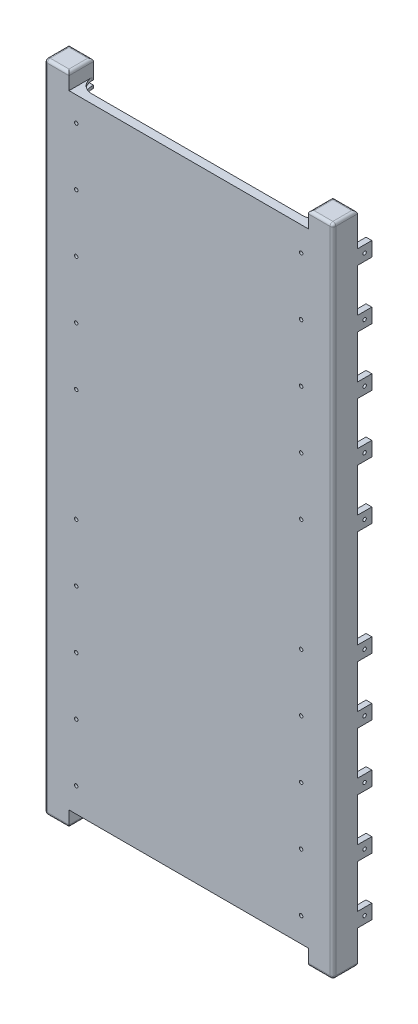
from build123d import *

# Parameters (mm, degrees)
BOSS_EXTRUDE1_DEPTH             = 227
FILLET1_R                       = 1
SKETCH2_W                       = 2
SKETCH2_H                       = 5
BOSS_EXTRUDE2_DEPTH             = 5
BOSS_EXTRUDE6_START             = -41.5
SKETCH13_W                      = 0.2
SKETCH13_H                      = 214
BOSS_EXTRUDE6_DEPTH             = 41.5
F_0_80_TAPPED_HOLE1_AT_2_COUNT  = 2
F_0_80_TAPPED_HOLE1_AT_2_PITCH  = 20
F_0_80_TAPPED_HOLE1_AT_3_COUNT  = 2
F_0_80_TAPPED_HOLE1_AT_3_PITCH  = 40
F_0_80_TAPPED_HOLE1_AT_4_COUNT  = 2
F_0_80_TAPPED_HOLE1_AT_4_PITCH  = 60
F_0_80_TAPPED_HOLE1_AT_5_COUNT  = 2
F_0_80_TAPPED_HOLE1_AT_5_PITCH  = 80
F_0_80_TAPPED_HOLE1_AT_6_COUNT  = 2
F_0_80_TAPPED_HOLE1_AT_6_PITCH  = 119
F_0_80_TAPPED_HOLE1_AT_7_COUNT  = 2
F_0_80_TAPPED_HOLE1_AT_7_PITCH  = 139
F_0_80_TAPPED_HOLE1_AT_8_COUNT  = 2
F_0_80_TAPPED_HOLE1_AT_8_PITCH  = 159
F_0_80_TAPPED_HOLE1_AT_9_COUNT  = 2
F_0_80_TAPPED_HOLE1_AT_9_PITCH  = 179
F_0_80_TAPPED_HOLE1_AT_10_COUNT = 2
F_0_80_TAPPED_HOLE1_AT_10_PITCH = 199
FILLET2_START                   = 2.25
FILLET2_DEPTH                   = 1.8
FILLET2_2_DEPTH                 = 2
CUT_EXTRUDE1_START              = -6.5
SKETCH3_W                       = 6.5
SKETCH3_H                       = 6.5
CUT_EXTRUDE1_DEPTH              = 214
MIRROR7_COPY_10_SKETCH_W        = 2
MIRROR7_COPY_10_SKETCH_H        = 5
MIRROR7_COPY_10_DEPTH           = 5
FILLET1_OF_MIRROR7_R            = 1
SKETCH14_W                      = 8.5
SKETCH14_H                      = 1
BOSS_EXTRUDE7_DEPTH             = 96
CUT_EXTRUDE2_DEPTH              = 242.486800882


with BuildPart() as part:
    # Sketch1 → Boss-Extrude1 (new body)
    with BuildSketch(Plane(origin=(0, 0, 0), x_dir=(1, 0, 0), z_dir=(0, 1, 0))):
        with BuildLine():
            Line((-3.25, -4.25), (4.25, -4.25))
            Line((4.25, -4.25), (4.25, 4.25))
            Line((4.25, 4.25), (-4.25, 4.25))
            Line((-4.25, 4.25), (-4.25, -3.25))
            ThreePointArc((-4.25, -3.25), (-3.957106781, -3.957106781), (-3.25, -4.25))
        make_face()
    boss_extrude1 = extrude(amount=BOSS_EXTRUDE1_DEPTH)

    # Fillet1
    fillet1_edges = [part.edges().sort_by_distance(p)[0] for p in [
        (-4.25, 227, -0.5),
        (-3.957106781, 227, 3.957106781),
        (0.5, 227, 4.25),
        (4.25, 227, 0),
        (0.5, 0, 4.25),
        (-3.957106781, 0, 3.957106781),
        (-4.25, 0, -0.5),
        (0, 0, -4.25),
        (4.25, 0, 0),
        (0, 227, -4.25),
    ]]
    fillet(fillet1_edges, radius=FILLET1_R)

    # Sketch2 → Boss-Extrude2 (add)
    with BuildSketch(Plane(origin=(4.25, 0, 0), x_dir=(0, 0, -1), z_dir=(1, 0, 0))):
        with Locations((-3.25, 213)):
            Rectangle(SKETCH2_W, SKETCH2_H)
        with Locations((-3.25, 193)):
            Rectangle(SKETCH2_W, SKETCH2_H)
        with Locations((-3.25, 173)):
            Rectangle(SKETCH2_W, SKETCH2_H)
        with Locations((-3.25, 153)):
            Rectangle(SKETCH2_W, SKETCH2_H)
        with Locations((-3.25, 133)):
            Rectangle(SKETCH2_W, SKETCH2_H)
        with Locations((-3.25, 94)):
            Rectangle(SKETCH2_W, SKETCH2_H)
        with Locations((-3.25, 74)):
            Rectangle(SKETCH2_W, SKETCH2_H)
        with Locations((-3.25, 54)):
            Rectangle(SKETCH2_W, SKETCH2_H)
        with Locations((-3.25, 34)):
            Rectangle(SKETCH2_W, SKETCH2_H)
        with Locations((-3.25, 14)):
            Rectangle(SKETCH2_W, SKETCH2_H)
    boss_extrude2 = extrude(amount=BOSS_EXTRUDE2_DEPTH)

    # Sketch13 → Boss-Extrude6 (add)
    with BuildSketch(Plane.ZY.offset(-4.25).offset(BOSS_EXTRUDE6_START)):
        with Locations((4.15, 113.5)):
            Rectangle(SKETCH13_W, SKETCH13_H)
    boss_extrude6 = extrude(amount=BOSS_EXTRUDE6_DEPTH)

    # Sketch11 → #0-80 Tapped Hole1 (revolve, cut)
    with BuildSketch(Plane(origin=(6.75, 213, 4.25), x_dir=(0, -1, 0), z_dir=(1, 0, 0))):
        Polygon((0, 0), (0, 4.358390611), (0.59563, 4.0005), (0.59563, 0), align=None)
    f_0_80_tapped_hole1 = revolve(axis=Axis((6.75, 213, 10.6), (0, 0, -1)), mode=Mode.SUBTRACT)

    # #0-80 Tapped Hole1 at 2: #0-80 Tapped Hole1 ×2
    with Locations(*[(0, -i * F_0_80_TAPPED_HOLE1_AT_2_PITCH, 0) for i in range(1, F_0_80_TAPPED_HOLE1_AT_2_COUNT)]):
        add(f_0_80_tapped_hole1, mode=Mode.SUBTRACT)

    # #0-80 Tapped Hole1 at 3: #0-80 Tapped Hole1 ×2
    with Locations(*[(0, -i * F_0_80_TAPPED_HOLE1_AT_3_PITCH, 0) for i in range(1, F_0_80_TAPPED_HOLE1_AT_3_COUNT)]):
        add(f_0_80_tapped_hole1, mode=Mode.SUBTRACT)

    # #0-80 Tapped Hole1 at 4: #0-80 Tapped Hole1 ×2
    with Locations(*[(0, -i * F_0_80_TAPPED_HOLE1_AT_4_PITCH, 0) for i in range(1, F_0_80_TAPPED_HOLE1_AT_4_COUNT)]):
        add(f_0_80_tapped_hole1, mode=Mode.SUBTRACT)

    # #0-80 Tapped Hole1 at 5: #0-80 Tapped Hole1 ×2
    with Locations(*[(0, -i * F_0_80_TAPPED_HOLE1_AT_5_PITCH, 0) for i in range(1, F_0_80_TAPPED_HOLE1_AT_5_COUNT)]):
        add(f_0_80_tapped_hole1, mode=Mode.SUBTRACT)

    # #0-80 Tapped Hole1 at 6: #0-80 Tapped Hole1 ×2
    with Locations(*[(0, -i * F_0_80_TAPPED_HOLE1_AT_6_PITCH, 0) for i in range(1, F_0_80_TAPPED_HOLE1_AT_6_COUNT)]):
        add(f_0_80_tapped_hole1, mode=Mode.SUBTRACT)

    # #0-80 Tapped Hole1 at 7: #0-80 Tapped Hole1 ×2
    with Locations(*[(0, -i * F_0_80_TAPPED_HOLE1_AT_7_PITCH, 0) for i in range(1, F_0_80_TAPPED_HOLE1_AT_7_COUNT)]):
        add(f_0_80_tapped_hole1, mode=Mode.SUBTRACT)

    # #0-80 Tapped Hole1 at 8: #0-80 Tapped Hole1 ×2
    with Locations(*[(0, -i * F_0_80_TAPPED_HOLE1_AT_8_PITCH, 0) for i in range(1, F_0_80_TAPPED_HOLE1_AT_8_COUNT)]):
        add(f_0_80_tapped_hole1, mode=Mode.SUBTRACT)

    # #0-80 Tapped Hole1 at 9: #0-80 Tapped Hole1 ×2
    with Locations(*[(0, -i * F_0_80_TAPPED_HOLE1_AT_9_PITCH, 0) for i in range(1, F_0_80_TAPPED_HOLE1_AT_9_COUNT)]):
        add(f_0_80_tapped_hole1, mode=Mode.SUBTRACT)

    # #0-80 Tapped Hole1 at 10: #0-80 Tapped Hole1 ×2
    with Locations(*[(0, -i * F_0_80_TAPPED_HOLE1_AT_10_PITCH, 0) for i in range(1, F_0_80_TAPPED_HOLE1_AT_10_COUNT)]):
        add(f_0_80_tapped_hole1, mode=Mode.SUBTRACT)

    # Fillet2: read off the stored shape, not the designer's step
    # Fillet2 outline → Fillet2 (cut)
    with BuildSketch(Plane.XY.offset(FILLET2_START)):
        with BuildLine():
            Line((9.25, 215.5), (6.75, 215.5))
            ThreePointArc((6.75, 215.5), (8.517766953, 214.767766953), (9.25, 213))
            Line((9.25, 213), (9.25, 215.5))
        make_face()
        with BuildLine():
            Line((9.25, 195.5), (6.75, 195.5))
            ThreePointArc((6.75, 195.5), (8.517766953, 194.767766953), (9.25, 193))
            Line((9.25, 193), (9.25, 195.5))
        make_face()
        with BuildLine():
            Line((9.25, 175.5), (6.75, 175.5))
            ThreePointArc((6.75, 175.5), (8.517766953, 174.767766953), (9.25, 173))
            Line((9.25, 173), (9.25, 175.5))
        make_face()
        with BuildLine():
            Line((9.25, 155.5), (6.75, 155.5))
            ThreePointArc((6.75, 155.5), (8.517766953, 154.767766953), (9.25, 153))
            Line((9.25, 153), (9.25, 155.5))
        make_face()
        with BuildLine():
            Line((9.25, 135.5), (6.75, 135.5))
            ThreePointArc((6.75, 135.5), (8.517766953, 134.767766953), (9.25, 133))
            Line((9.25, 133), (9.25, 135.5))
        make_face()
        with BuildLine():
            ThreePointArc((9.25, 94), (8.517766953, 92.232233047), (6.75, 91.5))
            Line((6.75, 91.5), (9.25, 91.5))
            Line((9.25, 91.5), (9.25, 94))
        make_face()
        with BuildLine():
            ThreePointArc((9.25, 74), (8.517766953, 72.232233047), (6.75, 71.5))
            Line((6.75, 71.5), (9.25, 71.5))
            Line((9.25, 71.5), (9.25, 74))
        make_face()
        with BuildLine():
            ThreePointArc((9.25, 54), (8.517766953, 52.232233047), (6.75, 51.5))
            Line((6.75, 51.5), (9.25, 51.5))
            Line((9.25, 51.5), (9.25, 54))
        make_face()
        with BuildLine():
            ThreePointArc((9.25, 34), (8.517766953, 32.232233047), (6.75, 31.5))
            Line((6.75, 31.5), (9.25, 31.5))
            Line((9.25, 31.5), (9.25, 34))
        make_face()
        with BuildLine():
            ThreePointArc((9.25, 14), (8.517766953, 12.232233047), (6.75, 11.5))
            Line((6.75, 11.5), (9.25, 11.5))
            Line((9.25, 11.5), (9.25, 14))
        make_face()
    fillet2 = extrude(amount=FILLET2_DEPTH, mode=Mode.SUBTRACT)

    # Fillet2 2 outline → Fillet2 2 (add)
    with BuildSketch(Plane.XY.offset(FILLET2_START)):
        with BuildLine():
            Line((4.25, 215.5), (6.75, 215.5))
            ThreePointArc((6.75, 215.5), (4.982233047, 216.232233047), (4.25, 218))
            Line((4.25, 218), (4.25, 215.5))
        make_face()
        with BuildLine():
            Line((6.75, 11.5), (4.25, 11.5))
            Line((4.25, 11.5), (4.25, 9))
            ThreePointArc((4.25, 9), (4.982233047, 10.767766953), (6.75, 11.5))
        make_face()
        with BuildLine():
            Line((6.75, 31.5), (4.25, 31.5))
            Line((4.25, 31.5), (4.25, 29))
            ThreePointArc((4.25, 29), (4.982233047, 30.767766953), (6.75, 31.5))
        make_face()
        with BuildLine():
            Line((6.75, 51.5), (4.25, 51.5))
            Line((4.25, 51.5), (4.25, 49))
            ThreePointArc((4.25, 49), (4.982233047, 50.767766953), (6.75, 51.5))
        make_face()
        with BuildLine():
            Line((6.75, 71.5), (4.25, 71.5))
            Line((4.25, 71.5), (4.25, 69))
            ThreePointArc((4.25, 69), (4.982233047, 70.767766953), (6.75, 71.5))
        make_face()
        with BuildLine():
            Line((6.75, 91.5), (4.25, 91.5))
            Line((4.25, 91.5), (4.25, 89))
            ThreePointArc((4.25, 89), (4.982233047, 90.767766953), (6.75, 91.5))
        make_face()
        with BuildLine():
            ThreePointArc((6.75, 135.5), (4.982233047, 136.232233047), (4.25, 138))
            Line((4.25, 138), (4.25, 135.5))
            Line((4.25, 135.5), (6.75, 135.5))
        make_face()
        with BuildLine():
            ThreePointArc((6.75, 155.5), (4.982233047, 156.232233047), (4.25, 158))
            Line((4.25, 158), (4.25, 155.5))
            Line((4.25, 155.5), (6.75, 155.5))
        make_face()
        with BuildLine():
            ThreePointArc((6.75, 175.5), (4.982233047, 176.232233047), (4.25, 178))
            Line((4.25, 178), (4.25, 175.5))
            Line((4.25, 175.5), (6.75, 175.5))
        make_face()
        with BuildLine():
            ThreePointArc((6.75, 195.5), (4.982233047, 196.232233047), (4.25, 198))
            Line((4.25, 198), (4.25, 195.5))
            Line((4.25, 195.5), (6.75, 195.5))
        make_face()
    fillet2_2 = extrude(amount=FILLET2_2_DEPTH)

    # Mirror1: Boss-Extrude2, #0-80 Tapped Hole1 across plane
    add(boss_extrude2.mirror(Plane(origin=(0, 0, 0), x_dir=(-0.7071067811865478, 0, 0.7071067811865472), z_dir=(-0.7071067811865475, 0, -0.7071067811865477))))
    add(f_0_80_tapped_hole1.mirror(Plane(origin=(0, 0, 0), x_dir=(-0.7071067811865478, 0, 0.7071067811865472), z_dir=(-0.7071067811865475, 0, -0.7071067811865477))), mode=Mode.SUBTRACT)

    # Mirror1 copy 1 sketch → Mirror1 copy 1 (revolve, cut)
    with BuildSketch(Plane(origin=(-4.25, 193, -6.75), x_dir=(0, -1, 0), z_dir=(0, 0, -1))):
        Polygon((0, 0), (0, -4.358390611), (0.59563, -4.0005), (0.59563, 0), align=None)
    revolve(axis=Axis((-10.6, 193, -6.75), (-1, 0, 0)), mode=Mode.SUBTRACT)

    # Mirror1 copy 2 sketch → Mirror1 copy 2 (revolve, cut)
    with BuildSketch(Plane(origin=(-4.25, 173, -6.75), x_dir=(0, -1, 0), z_dir=(0, 0, -1))):
        Polygon((0, 0), (0, -4.358390611), (0.59563, -4.0005), (0.59563, 0), align=None)
    revolve(axis=Axis((-10.6, 173, -6.75), (-1, 0, 0)), mode=Mode.SUBTRACT)

    # Mirror1 copy 3 sketch → Mirror1 copy 3 (revolve, cut)
    with BuildSketch(Plane(origin=(-4.25, 153, -6.75), x_dir=(0, -1, 0), z_dir=(0, 0, -1))):
        Polygon((0, 0), (0, -4.358390611), (0.59563, -4.0005), (0.59563, 0), align=None)
    revolve(axis=Axis((-10.6, 153, -6.75), (-1, 0, 0)), mode=Mode.SUBTRACT)

    # Mirror1 copy 4 sketch → Mirror1 copy 4 (revolve, cut)
    with BuildSketch(Plane(origin=(-4.25, 133, -6.75), x_dir=(0, -1, 0), z_dir=(0, 0, -1))):
        Polygon((0, 0), (0, -4.358390611), (0.59563, -4.0005), (0.59563, 0), align=None)
    revolve(axis=Axis((-10.6, 133, -6.75), (-1, 0, 0)), mode=Mode.SUBTRACT)

    # Mirror1 copy 5 sketch → Mirror1 copy 5 (revolve, cut)
    with BuildSketch(Plane(origin=(-4.25, 94, -6.75), x_dir=(0, -1, 0), z_dir=(0, 0, -1))):
        Polygon((0, 0), (0, -4.358390611), (0.59563, -4.0005), (0.59563, 0), align=None)
    revolve(axis=Axis((-10.6, 94, -6.75), (-1, 0, 0)), mode=Mode.SUBTRACT)

    # Mirror1 copy 6 sketch → Mirror1 copy 6 (revolve, cut)
    with BuildSketch(Plane(origin=(-4.25, 74, -6.75), x_dir=(0, -1, 0), z_dir=(0, 0, -1))):
        Polygon((0, 0), (0, -4.358390611), (0.59563, -4.0005), (0.59563, 0), align=None)
    revolve(axis=Axis((-10.6, 74, -6.75), (-1, 0, 0)), mode=Mode.SUBTRACT)

    # Mirror1 copy 7 sketch → Mirror1 copy 7 (revolve, cut)
    with BuildSketch(Plane(origin=(-4.25, 54, -6.75), x_dir=(0, -1, 0), z_dir=(0, 0, -1))):
        Polygon((0, 0), (0, -4.358390611), (0.59563, -4.0005), (0.59563, 0), align=None)
    revolve(axis=Axis((-10.6, 54, -6.75), (-1, 0, 0)), mode=Mode.SUBTRACT)

    # Mirror1 copy 8 sketch → Mirror1 copy 8 (revolve, cut)
    with BuildSketch(Plane(origin=(-4.25, 34, -6.75), x_dir=(0, -1, 0), z_dir=(0, 0, -1))):
        Polygon((0, 0), (0, -4.358390611), (0.59563, -4.0005), (0.59563, 0), align=None)
    revolve(axis=Axis((-10.6, 34, -6.75), (-1, 0, 0)), mode=Mode.SUBTRACT)

    # Mirror1 copy 9 sketch → Mirror1 copy 9 (revolve, cut)
    with BuildSketch(Plane(origin=(-4.25, 14, -6.75), x_dir=(0, -1, 0), z_dir=(0, 0, -1))):
        Polygon((0, 0), (0, -4.358390611), (0.59563, -4.0005), (0.59563, 0), align=None)
    revolve(axis=Axis((-10.6, 14, -6.75), (-1, 0, 0)), mode=Mode.SUBTRACT)

    # Sketch3 → Cut-Extrude1 (cut)
    with BuildSketch(Plane(origin=(0, 227, 0), x_dir=(1, 0, 0), z_dir=(0, 1, 0)).offset(CUT_EXTRUDE1_START)):
        with Locations((1, 1)):
            Rectangle(SKETCH3_W, SKETCH3_H)
    cut_extrude1 = extrude(amount=-CUT_EXTRUDE1_DEPTH, mode=Mode.SUBTRACT)

    # Mirror7: Boss-Extrude1, Boss-Extrude2, Boss-Extrude6, #0-80 Tapped Hole1, Fillet2, Fillet2 2, Cut-Extrude1 across plane
    add(boss_extrude1.mirror(Plane.ZY.offset(-45.75)))
    add(boss_extrude2.mirror(Plane.ZY.offset(-45.75)))
    add(boss_extrude6.mirror(Plane.ZY.offset(-45.75)))
    add(f_0_80_tapped_hole1.mirror(Plane.ZY.offset(-45.75)), mode=Mode.SUBTRACT)
    add(fillet2.mirror(Plane.ZY.offset(-45.75)), mode=Mode.SUBTRACT)
    add(fillet2_2.mirror(Plane.ZY.offset(-45.75)))
    add(cut_extrude1.mirror(Plane.ZY.offset(-45.75)), mode=Mode.SUBTRACT)

    # Mirror7 copy 1 sketch → Mirror7 copy 1 (revolve, cut)
    with BuildSketch(Plane(origin=(84.75, 193, 4.25), x_dir=(0, -1, 0), z_dir=(-1, 0, 0))):
        Polygon((0, 0), (0, -4.358390611), (0.59563, -4.0005), (0.59563, 0), align=None)
    revolve(axis=Axis((84.75, 193, 10.6), (0, 0, 1)), mode=Mode.SUBTRACT)

    # Mirror7 copy 2 sketch → Mirror7 copy 2 (revolve, cut)
    with BuildSketch(Plane(origin=(84.75, 173, 4.25), x_dir=(0, -1, 0), z_dir=(-1, 0, 0))):
        Polygon((0, 0), (0, -4.358390611), (0.59563, -4.0005), (0.59563, 0), align=None)
    revolve(axis=Axis((84.75, 173, 10.6), (0, 0, 1)), mode=Mode.SUBTRACT)

    # Mirror7 copy 3 sketch → Mirror7 copy 3 (revolve, cut)
    with BuildSketch(Plane(origin=(84.75, 153, 4.25), x_dir=(0, -1, 0), z_dir=(-1, 0, 0))):
        Polygon((0, 0), (0, -4.358390611), (0.59563, -4.0005), (0.59563, 0), align=None)
    revolve(axis=Axis((84.75, 153, 10.6), (0, 0, 1)), mode=Mode.SUBTRACT)

    # Mirror7 copy 4 sketch → Mirror7 copy 4 (revolve, cut)
    with BuildSketch(Plane(origin=(84.75, 133, 4.25), x_dir=(0, -1, 0), z_dir=(-1, 0, 0))):
        Polygon((0, 0), (0, -4.358390611), (0.59563, -4.0005), (0.59563, 0), align=None)
    revolve(axis=Axis((84.75, 133, 10.6), (0, 0, 1)), mode=Mode.SUBTRACT)

    # Mirror7 copy 5 sketch → Mirror7 copy 5 (revolve, cut)
    with BuildSketch(Plane(origin=(84.75, 94, 4.25), x_dir=(0, -1, 0), z_dir=(-1, 0, 0))):
        Polygon((0, 0), (0, -4.358390611), (0.59563, -4.0005), (0.59563, 0), align=None)
    revolve(axis=Axis((84.75, 94, 10.6), (0, 0, 1)), mode=Mode.SUBTRACT)

    # Mirror7 copy 6 sketch → Mirror7 copy 6 (revolve, cut)
    with BuildSketch(Plane(origin=(84.75, 74, 4.25), x_dir=(0, -1, 0), z_dir=(-1, 0, 0))):
        Polygon((0, 0), (0, -4.358390611), (0.59563, -4.0005), (0.59563, 0), align=None)
    revolve(axis=Axis((84.75, 74, 10.6), (0, 0, 1)), mode=Mode.SUBTRACT)

    # Mirror7 copy 7 sketch → Mirror7 copy 7 (revolve, cut)
    with BuildSketch(Plane(origin=(84.75, 54, 4.25), x_dir=(0, -1, 0), z_dir=(-1, 0, 0))):
        Polygon((0, 0), (0, -4.358390611), (0.59563, -4.0005), (0.59563, 0), align=None)
    revolve(axis=Axis((84.75, 54, 10.6), (0, 0, 1)), mode=Mode.SUBTRACT)

    # Mirror7 copy 8 sketch → Mirror7 copy 8 (revolve, cut)
    with BuildSketch(Plane(origin=(84.75, 34, 4.25), x_dir=(0, -1, 0), z_dir=(-1, 0, 0))):
        Polygon((0, 0), (0, -4.358390611), (0.59563, -4.0005), (0.59563, 0), align=None)
    revolve(axis=Axis((84.75, 34, 10.6), (0, 0, 1)), mode=Mode.SUBTRACT)

    # Mirror7 copy 9 sketch → Mirror7 copy 9 (revolve, cut)
    with BuildSketch(Plane(origin=(84.75, 14, 4.25), x_dir=(0, -1, 0), z_dir=(-1, 0, 0))):
        Polygon((0, 0), (0, -4.358390611), (0.59563, -4.0005), (0.59563, 0), align=None)
    revolve(axis=Axis((84.75, 14, 10.6), (0, 0, 1)), mode=Mode.SUBTRACT)

    # Mirror7 copy 10 sketch → Mirror7 copy 10 (add)
    with BuildSketch(Plane(origin=(91.5, 0, -4.25), x_dir=(-1, 0, 0), z_dir=(0, 0, -1))):
        with Locations((-3.25, 213)):
            Rectangle(MIRROR7_COPY_10_SKETCH_W, MIRROR7_COPY_10_SKETCH_H)
        with Locations((-3.25, 193)):
            Rectangle(MIRROR7_COPY_10_SKETCH_W, MIRROR7_COPY_10_SKETCH_H)
        with Locations((-3.25, 173)):
            Rectangle(MIRROR7_COPY_10_SKETCH_W, MIRROR7_COPY_10_SKETCH_H)
        with Locations((-3.25, 153)):
            Rectangle(MIRROR7_COPY_10_SKETCH_W, MIRROR7_COPY_10_SKETCH_H)
        with Locations((-3.25, 133)):
            Rectangle(MIRROR7_COPY_10_SKETCH_W, MIRROR7_COPY_10_SKETCH_H)
        with Locations((-3.25, 94)):
            Rectangle(MIRROR7_COPY_10_SKETCH_W, MIRROR7_COPY_10_SKETCH_H)
        with Locations((-3.25, 74)):
            Rectangle(MIRROR7_COPY_10_SKETCH_W, MIRROR7_COPY_10_SKETCH_H)
        with Locations((-3.25, 54)):
            Rectangle(MIRROR7_COPY_10_SKETCH_W, MIRROR7_COPY_10_SKETCH_H)
        with Locations((-3.25, 34)):
            Rectangle(MIRROR7_COPY_10_SKETCH_W, MIRROR7_COPY_10_SKETCH_H)
        with Locations((-3.25, 14)):
            Rectangle(MIRROR7_COPY_10_SKETCH_W, MIRROR7_COPY_10_SKETCH_H)
    extrude(amount=MIRROR7_COPY_10_DEPTH)

    # Mirror7 copy 11 sketch → Mirror7 copy 11 (revolve, cut)
    with BuildSketch(Plane(origin=(95.75, 213, -6.75), x_dir=(0, -1, 0), z_dir=(0, 0, -1))):
        Polygon((0, 0), (0, 4.358390611), (0.59563, 4.0005), (0.59563, 0), align=None)
    revolve(axis=Axis((102.1, 213, -6.75), (-1, 0, 0)), mode=Mode.SUBTRACT)

    # Mirror7 copy 12 sketch → Mirror7 copy 12 (revolve, cut)
    with BuildSketch(Plane(origin=(95.75, 193, -6.75), x_dir=(0, -1, 0), z_dir=(0, 0, -1))):
        Polygon((0, 0), (0, 4.358390611), (0.59563, 4.0005), (0.59563, 0), align=None)
    revolve(axis=Axis((102.1, 193, -6.75), (-1, 0, 0)), mode=Mode.SUBTRACT)

    # Mirror7 copy 13 sketch → Mirror7 copy 13 (revolve, cut)
    with BuildSketch(Plane(origin=(95.75, 173, -6.75), x_dir=(0, -1, 0), z_dir=(0, 0, -1))):
        Polygon((0, 0), (0, 4.358390611), (0.59563, 4.0005), (0.59563, 0), align=None)
    revolve(axis=Axis((102.1, 173, -6.75), (-1, 0, 0)), mode=Mode.SUBTRACT)

    # Mirror7 copy 14 sketch → Mirror7 copy 14 (revolve, cut)
    with BuildSketch(Plane(origin=(95.75, 153, -6.75), x_dir=(0, -1, 0), z_dir=(0, 0, -1))):
        Polygon((0, 0), (0, 4.358390611), (0.59563, 4.0005), (0.59563, 0), align=None)
    revolve(axis=Axis((102.1, 153, -6.75), (-1, 0, 0)), mode=Mode.SUBTRACT)

    # Mirror7 copy 15 sketch → Mirror7 copy 15 (revolve, cut)
    with BuildSketch(Plane(origin=(95.75, 133, -6.75), x_dir=(0, -1, 0), z_dir=(0, 0, -1))):
        Polygon((0, 0), (0, 4.358390611), (0.59563, 4.0005), (0.59563, 0), align=None)
    revolve(axis=Axis((102.1, 133, -6.75), (-1, 0, 0)), mode=Mode.SUBTRACT)

    # Mirror7 copy 16 sketch → Mirror7 copy 16 (revolve, cut)
    with BuildSketch(Plane(origin=(95.75, 94, -6.75), x_dir=(0, -1, 0), z_dir=(0, 0, -1))):
        Polygon((0, 0), (0, 4.358390611), (0.59563, 4.0005), (0.59563, 0), align=None)
    revolve(axis=Axis((102.1, 94, -6.75), (-1, 0, 0)), mode=Mode.SUBTRACT)

    # Mirror7 copy 17 sketch → Mirror7 copy 17 (revolve, cut)
    with BuildSketch(Plane(origin=(95.75, 74, -6.75), x_dir=(0, -1, 0), z_dir=(0, 0, -1))):
        Polygon((0, 0), (0, 4.358390611), (0.59563, 4.0005), (0.59563, 0), align=None)
    revolve(axis=Axis((102.1, 74, -6.75), (-1, 0, 0)), mode=Mode.SUBTRACT)

    # Mirror7 copy 18 sketch → Mirror7 copy 18 (revolve, cut)
    with BuildSketch(Plane(origin=(95.75, 54, -6.75), x_dir=(0, -1, 0), z_dir=(0, 0, -1))):
        Polygon((0, 0), (0, 4.358390611), (0.59563, 4.0005), (0.59563, 0), align=None)
    revolve(axis=Axis((102.1, 54, -6.75), (-1, 0, 0)), mode=Mode.SUBTRACT)

    # Mirror7 copy 19 sketch → Mirror7 copy 19 (revolve, cut)
    with BuildSketch(Plane(origin=(95.75, 34, -6.75), x_dir=(0, -1, 0), z_dir=(0, 0, -1))):
        Polygon((0, 0), (0, 4.358390611), (0.59563, 4.0005), (0.59563, 0), align=None)
    revolve(axis=Axis((102.1, 34, -6.75), (-1, 0, 0)), mode=Mode.SUBTRACT)

    # Mirror7 copy 20 sketch → Mirror7 copy 20 (revolve, cut)
    with BuildSketch(Plane(origin=(95.75, 14, -6.75), x_dir=(0, -1, 0), z_dir=(0, 0, -1))):
        Polygon((0, 0), (0, 4.358390611), (0.59563, 4.0005), (0.59563, 0), align=None)
    revolve(axis=Axis((102.1, 14, -6.75), (-1, 0, 0)), mode=Mode.SUBTRACT)

    # Fillet1 of Mirror7
    fillet1_of_mirror7_edges = [part.edges().sort_by_distance(p)[0] for p in [
        (95.75, 227, -0.5),
        (95.457106781, 227, 3.957106781),
        (91, 227, 4.25),
        (87.25, 227, 0),
        (91, 0, 4.25),
        (95.457106781, 0, 3.957106781),
        (95.75, 0, -0.5),
        (91.5, 0, -4.25),
        (87.25, 0, 0),
        (91.5, 227, -4.25),
    ]]
    fillet(fillet1_of_mirror7_edges, radius=FILLET1_OF_MIRROR7_R)

    # Sketch14 → Boss-Extrude7 (add)
    with BuildSketch(Plane(origin=(-2.25, 0, 0), x_dir=(0, 0, -1), z_dir=(1, 0, 0))):
        with Locations((0, 8.6)):
            Rectangle(SKETCH14_W, SKETCH14_H)
        with Locations((0, 18.6)):
            Rectangle(SKETCH14_W, SKETCH14_H)
        with Locations((0, 6)):
            Rectangle(SKETCH14_W, SKETCH14_H)
        with Locations((0, 16)):
            Rectangle(SKETCH14_W, SKETCH14_H)
        with Locations((0, 28.6)):
            Rectangle(SKETCH14_W, SKETCH14_H)
        with Locations((0, 26)):
            Rectangle(SKETCH14_W, SKETCH14_H)
        with Locations((0, 38.6)):
            Rectangle(SKETCH14_W, SKETCH14_H)
        with Locations((0, 36)):
            Rectangle(SKETCH14_W, SKETCH14_H)
        with Locations((0, 48.6)):
            Rectangle(SKETCH14_W, SKETCH14_H)
        with Locations((0, 46)):
            Rectangle(SKETCH14_W, SKETCH14_H)
        with Locations((0, 58.6)):
            Rectangle(SKETCH14_W, SKETCH14_H)
        with Locations((0, 56)):
            Rectangle(SKETCH14_W, SKETCH14_H)
        with Locations((0, 68.6)):
            Rectangle(SKETCH14_W, SKETCH14_H)
        with Locations((0, 66)):
            Rectangle(SKETCH14_W, SKETCH14_H)
        with Locations((0, 78.6)):
            Rectangle(SKETCH14_W, SKETCH14_H)
        with Locations((0, 76)):
            Rectangle(SKETCH14_W, SKETCH14_H)
        with Locations((0, 88.6)):
            Rectangle(SKETCH14_W, SKETCH14_H)
        with Locations((0, 86)):
            Rectangle(SKETCH14_W, SKETCH14_H)
        with Locations((0, 98.6)):
            Rectangle(SKETCH14_W, SKETCH14_H)
        with Locations((0, 96)):
            Rectangle(SKETCH14_W, SKETCH14_H)
        with Locations((0, 108.6)):
            Rectangle(SKETCH14_W, SKETCH14_H)
        with Locations((0, 106)):
            Rectangle(SKETCH14_W, SKETCH14_H)
        with Locations((0, 121)):
            Rectangle(SKETCH14_W, SKETCH14_H)
        with Locations((0, 118.4)):
            Rectangle(SKETCH14_W, SKETCH14_H)
        with Locations((0, 131)):
            Rectangle(SKETCH14_W, SKETCH14_H)
        with Locations((0, 128.4)):
            Rectangle(SKETCH14_W, SKETCH14_H)
        with Locations((0, 141)):
            Rectangle(SKETCH14_W, SKETCH14_H)
        with Locations((0, 138.4)):
            Rectangle(SKETCH14_W, SKETCH14_H)
        with Locations((0, 151)):
            Rectangle(SKETCH14_W, SKETCH14_H)
        with Locations((0, 148.4)):
            Rectangle(SKETCH14_W, SKETCH14_H)
        with Locations((0, 161)):
            Rectangle(SKETCH14_W, SKETCH14_H)
        with Locations((0, 158.4)):
            Rectangle(SKETCH14_W, SKETCH14_H)
        with Locations((0, 171)):
            Rectangle(SKETCH14_W, SKETCH14_H)
        with Locations((0, 168.4)):
            Rectangle(SKETCH14_W, SKETCH14_H)
        with Locations((0, 181)):
            Rectangle(SKETCH14_W, SKETCH14_H)
        with Locations((0, 178.4)):
            Rectangle(SKETCH14_W, SKETCH14_H)
        with Locations((0, 191)):
            Rectangle(SKETCH14_W, SKETCH14_H)
        with Locations((0, 188.4)):
            Rectangle(SKETCH14_W, SKETCH14_H)
        with Locations((0, 201)):
            Rectangle(SKETCH14_W, SKETCH14_H)
        with Locations((0, 198.4)):
            Rectangle(SKETCH14_W, SKETCH14_H)
        with Locations((0, 211)):
            Rectangle(SKETCH14_W, SKETCH14_H)
        with Locations((0, 208.4)):
            Rectangle(SKETCH14_W, SKETCH14_H)
        with Locations((0, 221)):
            Rectangle(SKETCH14_W, SKETCH14_H)
        with Locations((0, 218.4)):
            Rectangle(SKETCH14_W, SKETCH14_H)
    extrude(amount=BOSS_EXTRUDE7_DEPTH)

    # Sketch15 → Cut-Extrude2 (cut, through all)
    with BuildSketch(Plane.XZ.offset(-5.5)):
        with BuildLine():
            Line((4.25, -4.25), (4.25, -3.75))
            ThreePointArc((4.25, -3.75), (5.714466094, -0.214466094), (9.25, 1.25))
            Line((9.25, 1.25), (82.25, 1.25))
            ThreePointArc((82.25, 1.25), (85.785533906, -0.214466094), (87.25, -3.75))
            Line((87.25, -3.75), (87.25, -4.25))
            Line((87.25, -4.25), (4.25, -4.25))
        make_face()
    extrude(amount=-CUT_EXTRUDE2_DEPTH, mode=Mode.SUBTRACT)


solid = part.part
